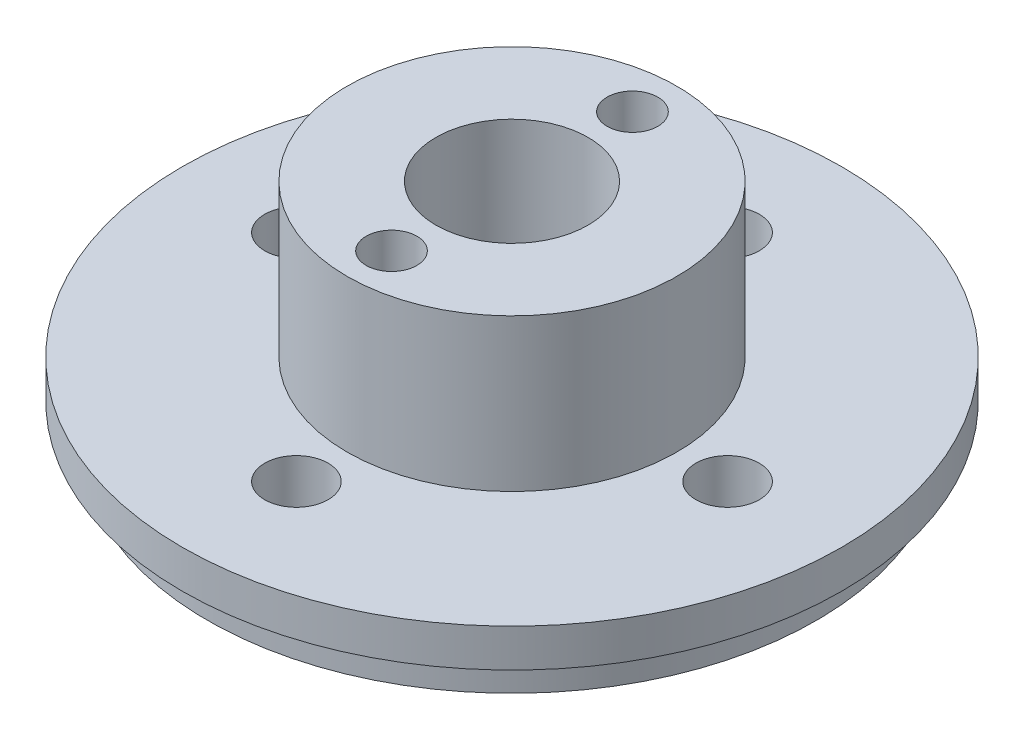
from build123d import *

# Parameters (mm, degrees)
SKETCH1_R           = 13
BOSS_EXTRUDE1_DEPTH = 1.5
SKETCH2_R           = 6.5
BOSS_EXTRUDE2_DEPTH = 6
SKETCH3_R           = 3
CUT_EXTRUDE1_DEPTH  = 6
SKETCH4_R           = 1.25
CUT_EXTRUDE5_DEPTH  = 8
SKETCH6_R           = 1
CUT_EXTRUDE6_DEPTH  = 6
SKETCH7_R           = 12
SKETCH7_R_2         = 2
BOSS_EXTRUDE3_DEPTH = 1.5
SKETCH8_R           = 6.5
SKETCH8_R_2         = 2
BOSS_EXTRUDE4_DEPTH = 0.8
CUT_EXTRUDE8_START  = -10.8
SKETCH9_R           = 1.25
CUT_EXTRUDE8_DEPTH  = 10.8
CUT_EXTRUDE9_START  = -10.8
SKETCH10_R          = 2
CUT_EXTRUDE9_DEPTH  = 10.8
CUT_EXTRUDE10_DEPTH = 0.8
CHAMFER4_SIZE       = 1


with BuildPart() as part:
    # Sketch1 → Boss-Extrude1 (new body)
    with BuildSketch(Plane(origin=(0, 0, 0), x_dir=(1, 0, 0), z_dir=(0, 1, 0))):
        with Locations(Location((0, 0, 0), (0, 0, 270))):
            Circle(SKETCH1_R)
    extrude(amount=BOSS_EXTRUDE1_DEPTH)

    # Sketch2 → Boss-Extrude2 (add)
    with BuildSketch(Plane(origin=(0, 1.5, 0), x_dir=(1, 0, 0), z_dir=(0, 1, 0))):
        with Locations(Location((0, 0, 0), (0, 0, 270))):
            Circle(SKETCH2_R)
    extrude(amount=BOSS_EXTRUDE2_DEPTH)

    # Sketch3 → Cut-Extrude1 (cut)
    with BuildSketch(Plane(origin=(0, 7.5, 0), x_dir=(1, 0, 0), z_dir=(0, 1, 0))):
        with Locations(Location((0, 0, 0), (0, 0, 270))):
            Circle(SKETCH3_R)
    extrude(amount=-CUT_EXTRUDE1_DEPTH, mode=Mode.SUBTRACT)

    # Sketch4 → Cut-Extrude5 (cut, symmetric)
    with BuildSketch(Plane.XZ):
        with Locations(Location((-8.5, 0, 0), (0, 0, 90))):
            Circle(SKETCH4_R)
        with Locations(Location((0, 8.5, 0), (0, 0, 90))):
            Circle(SKETCH4_R)
        with Locations(Location((8.5, 0, 0), (0, 0, 90))):
            Circle(SKETCH4_R)
        with Locations(Location((0, -8.5, 0), (0, 0, 90))):
            Circle(SKETCH4_R)
    extrude(amount=CUT_EXTRUDE5_DEPTH, both=True, mode=Mode.SUBTRACT)

    # Sketch6 → Cut-Extrude6 (cut)
    with BuildSketch(Plane(origin=(0, 7.5, 0), x_dir=(1, 0, 0), z_dir=(0, 1, 0))):
        with Locations(Location((0, 4.75, 0), (0, 0, 270))):
            Circle(SKETCH6_R)
        with Locations(Location((0, -4.75, 0), (0, 0, 270))):
            Circle(SKETCH6_R)
    extrude(amount=-CUT_EXTRUDE6_DEPTH, mode=Mode.SUBTRACT)

    # Sketch7 → Boss-Extrude3 (add)
    with BuildSketch(Plane.XZ):
        with Locations(Location((0, 0, 0), (0, 0, 270))):
            Circle(SKETCH7_R)
        with Locations(Location((0, 0, 0), (0, 0, 270))):
            Circle(SKETCH7_R_2, mode=Mode.SUBTRACT)
    extrude(amount=BOSS_EXTRUDE3_DEPTH)

    # Sketch8 → Boss-Extrude4 (add)
    with BuildSketch(Plane.XZ.offset(1.5)):
        with Locations(Location((0, 0, 0), (0, 0, 90))):
            Circle(SKETCH8_R)
        with Locations(Location((0, 0, 0), (0, 0, 270))):
            Circle(SKETCH8_R_2, mode=Mode.SUBTRACT)
    extrude(amount=BOSS_EXTRUDE4_DEPTH)

    # Sketch9 → Cut-Extrude8 (cut)
    with BuildSketch(Plane(origin=(0, 0, 0), x_dir=(1, 0, 0), z_dir=(0, 1, 0)).offset(CUT_EXTRUDE8_START)):
        with Locations(Location((8.5, 0, 0), (0, 0, 90))):
            Circle(SKETCH9_R)
        with Locations(Location((0, -8.5, 0), (0, 0, 90))):
            Circle(SKETCH9_R)
        with Locations(Location((-8.5, 0, 0), (0, 0, 90))):
            Circle(SKETCH9_R)
        with Locations(Location((0, 8.5, 0), (0, 0, 90))):
            Circle(SKETCH9_R)
    extrude(amount=CUT_EXTRUDE8_DEPTH, mode=Mode.SUBTRACT)

    # Sketch10 → Cut-Extrude9 (cut)
    with BuildSketch(Plane.XZ.offset(CUT_EXTRUDE9_START)):
        with Locations(Location((0, 0, 0), (0, 0, 90))):
            Circle(SKETCH10_R)
    extrude(amount=CUT_EXTRUDE9_DEPTH, mode=Mode.SUBTRACT)

    # Sketch11 → Cut-Extrude10 (cut)
    with BuildSketch(Plane.XZ.offset(2.3)):
        with BuildLine():
            Line((-6.109126461, 2.220039164), (-3.889087297, 0))
            Line((-3.889087297, 0), (0, 3.889087297))
            Line((0, 3.889087297), (-2.220039164, 6.109126461))
            ThreePointArc((-2.220039164, 6.109126461), (-4.596194078, 4.596194078), (-6.109126461, 2.220039164))
        make_face()
    extrude(amount=-CUT_EXTRUDE10_DEPTH, mode=Mode.SUBTRACT)

    # Chamfer4
    chamfer4_edges = [part.edges().sort_by_distance(p)[0] for p in [
        (0, 1.5, -2),
    ]]
    chamfer(chamfer4_edges, length=CHAMFER4_SIZE - 0.0001)  # a hair under: the kernel refuses the full size


solid = part.part
